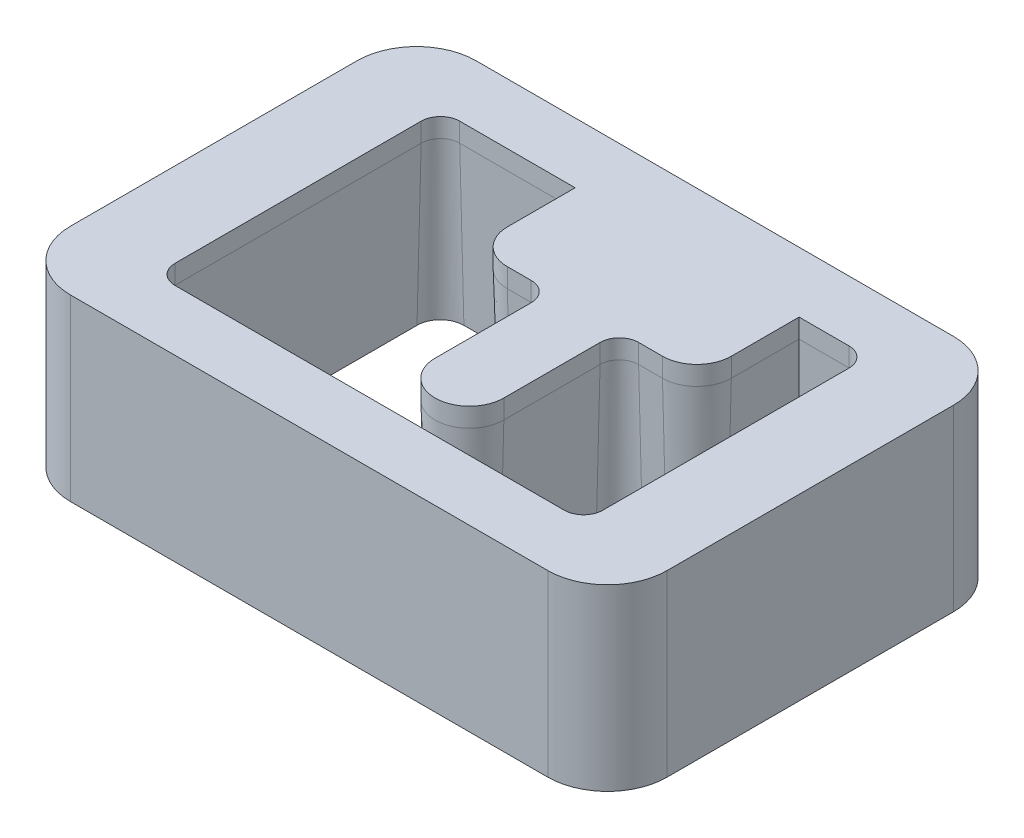
from build123d import *

# Parameters (mm, degrees)
SKETCH1_W                   = 100
SKETCH1_H                   = 68
BOSS_EXTRUDE1_DEPTH         = 30
FILLET1_R                   = 10
CUT_EXTRUDE1_REACH          = 69.498
M6_TAPPED_HOLE1_D           = 5
M6_TAPPED_HOLE1_DEPTH       = 17
M6_TAPPED_HOLE1_CSINK_D     = 6.05
M6_TAPPED_HOLE1_CSINK_ANGLE = 90
M6_TAPPED_HOLE1_TIP         = 1.502151548


with BuildPart() as part:
    # Sketch1 → Boss-Extrude1 (new body)
    with BuildSketch(Plane(origin=(0, 0, 0), x_dir=(1, 0, 0), z_dir=(0, 1, 0))):
        Rectangle(SKETCH1_W, SKETCH1_H)
    extrude(amount=-BOSS_EXTRUDE1_DEPTH)

    # Fillet1
    fillet1_edges = [part.edges().sort_by_distance(p)[0] for p in [
        (-50, -15, -34),
        (50, -15, -34),
        (50, -15, 34),
        (-50, -15, 34),
    ]]
    fillet(fillet1_edges, radius=FILLET1_R)

    # Sketch2 → Cut-Extrude1 (cut, up to next)
    with BuildSketch(Plane(origin=(0, 0, 0), x_dir=(1, 0, 0), z_dir=(0, 1, 0)), mode=Mode.PRIVATE) as cut_extrude1_sk1:
        with BuildLine():
            Line((-32.625, -23.86), (32.625, -23.86))
            ThreePointArc((32.625, -23.86), (34.908954903, -22.913954903), (35.855, -20.63))
            Line((35.855, -20.63), (35.855, 20.63))
            ThreePointArc((35.855, 20.63), (34.908954903, 22.913954903), (32.625, 23.86))
            Line((32.625, 23.86), (24.265, 23.86))
            Line((24.265, 23.86), (24.265, 12.5))
            ThreePointArc((24.265, 12.5), (22.575006127, 8.419993873), (18.495, 6.73))
            Line((18.495, 6.73), (14.495, 6.73))
            ThreePointArc((14.495, 6.73), (12.211045097, 5.783954903), (11.265, 3.5))
            Line((11.265, 3.5), (11.265, -12.63))
            ThreePointArc((11.265, -12.63), (5.495, -18.4), (-0.275, -12.63))
            Line((-0.275, -12.63), (-0.275, 3.5))
            ThreePointArc((-0.275, 3.5), (-1.221045097, 5.783954903), (-3.505, 6.73))
            Line((-3.505, 6.73), (-7.505, 6.73))
            ThreePointArc((-7.505, 6.73), (-11.585006127, 8.419993873), (-13.275, 12.5))
            Line((-13.275, 12.5), (-13.275, 23.86))
            Line((-13.275, 23.86), (-32.625, 23.86))
            ThreePointArc((-32.625, 23.86), (-34.908954903, 22.913954903), (-35.855, 20.63))
            Line((-35.855, 20.63), (-35.855, -20.63))
            ThreePointArc((-35.855, -20.63), (-34.908954903, -22.913954903), (-32.625, -23.86))
        make_face()
    cut_extrude1_tool1 = extrude(cut_extrude1_sk1.sketch, amount=-CUT_EXTRUDE1_REACH, mode=Mode.PRIVATE) & part.part
    add(cut_extrude1_tool1.solids().sort_by_distance((-1.994633, 0, 3.314696))[0], mode=Mode.SUBTRACT)

    # Cut-Sweep1: sweep along a path in Sketch5
    with BuildLine(Plane(origin=(0, 0, 0), x_dir=(1, 0, 0), z_dir=(0, 1, 0))) as cut_sweep1_path:
        Line((-32.625, -23.86), (32.625, -23.86))
        ThreePointArc((32.625, -23.86), (34.908954903, -22.913954903), (35.855, -20.63))
        Line((35.855, -20.63), (35.855, 20.63))
        ThreePointArc((35.855, 20.63), (34.908954903, 22.913954903), (32.625, 23.86))
        Line((32.625, 23.86), (24.265, 23.86))
        Line((24.265, 23.86), (24.265, 12.5))
        ThreePointArc((24.265, 12.5), (22.575006127, 8.419993873), (18.495, 6.73))
        Line((18.495, 6.73), (14.495, 6.73))
        ThreePointArc((14.495, 6.73), (12.211045097, 5.783954903), (11.265, 3.5))
        Line((11.265, 3.5), (11.265, -12.63))
        ThreePointArc((11.265, -12.63), (5.495, -18.4), (-0.275, -12.63))
        Line((-0.275, -12.63), (-0.275, 3.5))
        ThreePointArc((-0.275, 3.5), (-1.221045097, 5.783954903), (-3.505, 6.73))
        Line((-3.505, 6.73), (-7.505, 6.73))
        ThreePointArc((-7.505, 6.73), (-11.585006127, 8.419993873), (-13.275, 12.5))
        Line((-13.275, 12.5), (-13.275, 23.86))
        Line((-13.275, 23.86), (-32.625, 23.86))
        ThreePointArc((-32.625, 23.86), (-34.908954903, 22.913954903), (-35.855, 20.63))
        Line((-35.855, 20.63), (-35.855, -20.63))
        ThreePointArc((-35.855, -20.63), (-34.908954903, -22.913954903), (-32.625, -23.86))
    # Sketch3 → Cut-Sweep1 (sweep, cut)
    with BuildSketch(Plane.XY):
        Polygon((35.855, -3.2), (36.556782698, -30), (34.855, -30), (34.855, -3.2), align=None)
    sweep(path=cut_sweep1_path.line, transition=Transition.RIGHT, mode=Mode.SUBTRACT)

    # M6 Tapped Hole1
    with Locations(Plane(origin=(0, -30, 0), x_dir=(-1, 0, 0), z_dir=(0, -1, 0))):
        with Locations((-43, 27), (43, 27), (43, -27), (-43, -27)):
            CounterSinkHole(M6_TAPPED_HOLE1_D / 2, M6_TAPPED_HOLE1_CSINK_D / 2, depth=M6_TAPPED_HOLE1_DEPTH, counter_sink_angle=M6_TAPPED_HOLE1_CSINK_ANGLE)
            with Locations((0, 0, -(M6_TAPPED_HOLE1_DEPTH + M6_TAPPED_HOLE1_TIP / 2))):  # 118° drill point
                Cone(0, M6_TAPPED_HOLE1_D / 2, M6_TAPPED_HOLE1_TIP, mode=Mode.SUBTRACT)


solid = part.part
